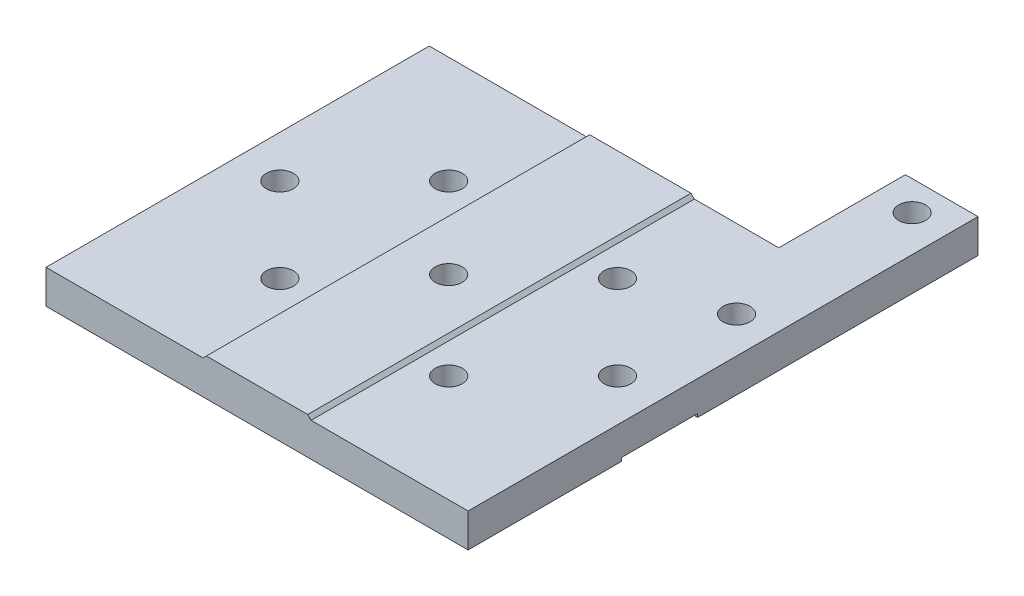
from build123d import *

# Parameters (mm, degrees)
SKETCH_1_W          = 50
SKETCH_1_H          = 45.4
SKETCH_1_R          = 1.6
EXTRUDE_1_DEPTH     = 4
SKETCH_2_W          = 12
SKETCH_2_H          = 0.4
EXTRUDE_2_DEPTH     = 45.4
CHAMFER_1_SIZE      = 0.4
SKETCH_3_W          = 50
SKETCH_3_H          = 9
CUT_EXTRUDE_1_DEPTH = 0.4
SKETCH_4_R          = 1.6
CUT_EXTRUDE_2_DEPTH = 68.654711588
SKETCH_5_W          = 8.6
SKETCH_5_H          = 15
EXTRUDE_3_DEPTH     = 4
SKETCH_6_R          = 1.6
CUT_EXTRUDE_3_DEPTH = 4


with BuildPart() as part:
    # 草图1 → 凸台-拉伸1 (new body)
    with BuildSketch(Plane(origin=(0, 0, 0), x_dir=(1, 0, 0), z_dir=(0, 1, 0))):
        with Locations((25, 22.7)):
            Rectangle(SKETCH_1_W, SKETCH_1_H)
        with Locations(Location((15, 32.7, 0), (0, 0, 270))):
            Circle(SKETCH_1_R, mode=Mode.SUBTRACT)
        with Locations(Location((35, 32.7, 0), (0, 0, 270))):
            Circle(SKETCH_1_R, mode=Mode.SUBTRACT)
        with Locations(Location((35, 12.7, 0), (0, 0, 270))):
            Circle(SKETCH_1_R, mode=Mode.SUBTRACT)
        with Locations(Location((15, 12.7, 0), (0, 0, 270))):
            Circle(SKETCH_1_R, mode=Mode.SUBTRACT)
    extrude(amount=EXTRUDE_1_DEPTH)

    # 草图2 → 凸台-拉伸2 (add)
    with BuildSketch(Plane.XY):
        with Locations((25, 4.2)):
            Rectangle(SKETCH_2_W, SKETCH_2_H)
    extrude(amount=-EXTRUDE_2_DEPTH)

    # 倒角1
    chamfer_1_edges = [part.edges().sort_by_distance(p)[0] for p in [
        (31, 4, -22.7),
        (19, 4, -22.7),
    ]]
    chamfer(chamfer_1_edges, length=CHAMFER_1_SIZE - 0.0001)  # a hair under: the kernel refuses the full size

    # 草图3 → 切除-拉伸1 (cut)
    with BuildSketch(Plane(origin=(0, 0, 0), x_dir=(-1, 0, 0), z_dir=(0, -1, 0))):
        with Locations((-25, 22.7)):
            Rectangle(SKETCH_3_W, SKETCH_3_H)
    extrude(amount=-CUT_EXTRUDE_1_DEPTH, mode=Mode.SUBTRACT)

    # 草图4 → 切除-拉伸2 (cut, through all)
    with BuildSketch(Plane(origin=(0, 0.4, 0), x_dir=(-1, 0, 0), z_dir=(0, -1, 0))):
        with Locations(Location((-5, 22.7, 0), (0, 0, 90))):
            Circle(SKETCH_4_R)
        with Locations(Location((-25, 22.7, 0), (0, 0, 90))):
            Circle(SKETCH_4_R)
        with Locations(Location((-45, 22.7, 0), (0, 0, 90))):
            Circle(SKETCH_4_R)
    extrude(amount=-CUT_EXTRUDE_2_DEPTH, mode=Mode.SUBTRACT)

    # 草图5 → 凸台-拉伸3 (add)
    with BuildSketch(Plane(origin=(0, 4, 0), x_dir=(1, 0, 0), z_dir=(0, 1, 0))):
        with Locations((45.7, 52.9)):
            Rectangle(SKETCH_5_W, SKETCH_5_H)
    extrude(amount=-EXTRUDE_3_DEPTH)

    # 草图6 → 切除-拉伸3 (cut)
    with BuildSketch(Plane.XZ):
        with Locations(Location((45.7, -56.9, 0), (0, 0, 270))):
            Circle(SKETCH_6_R)
        with Locations(Location((45.7, -36.1, 0), (0, 0, 270))):
            Circle(SKETCH_6_R)
    extrude(amount=-CUT_EXTRUDE_3_DEPTH, mode=Mode.SUBTRACT)


solid = part.part
